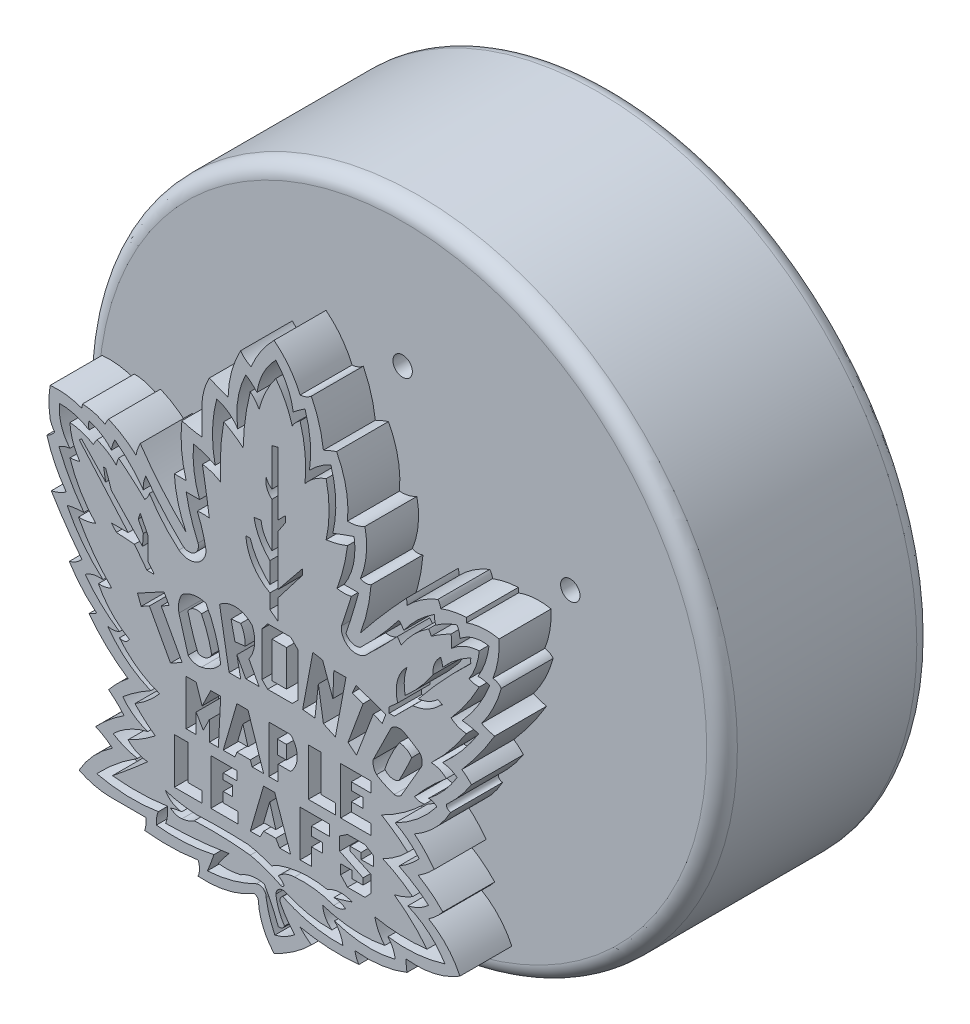
from build123d import *

# Parameters (mm, degrees)
BOSS_EXTRUDE1_DEPTH   = 6.35
SKETCH1_W             = 2.852961581
SKETCH1_H             = 7.051158855
BOSS_EXTRUDE1_2_DEPTH = 6.35
BOSS_EXTRUDE1_3_DEPTH = 6.35
BOSS_EXTRUDE1_4_DEPTH = 6.35
SKETCH1_W_2           = 1.81036161
SKETCH1_H_2           = 2.664627355
BOSS_EXTRUDE1_5_DEPTH = 6.35
BOSS_EXTRUDE1_6_DEPTH = 6.35
BOSS_EXTRUDE1_7_DEPTH = 6.35
BOSS_EXTRUDE1_8_DEPTH = 6.35
BOSS_EXTRUDE1_9_DEPTH = 6.35
BOSS_EXTRUDE2_DEPTH   = 3.81
CUT_EXTRUDE1_START    = -10
CUT_EXTRUDE1_DEPTH    = 10
SKETCH9_R             = 1.5
BOSS_EXTRUDE5_DEPTH   = 5
CHAMFER1_SIZE         = 1
SKETCH12_R            = 62.5
BOSS_EXTRUDE6_DEPTH   = 41.1
SKETCH11_R            = 1.9
CUT_EXTRUDE2_DEPTH    = 5.5
FILLET2_R             = 3


with BuildPart() as part:
    # Sketch1 → Boss-Extrude1 (new body)
    with BuildSketch(Plane.XY):
        with BuildLine():
            ThreePointArc((31.777083768, 91.475184901), (30.744210781, 88.89988469), (30.316738198, 86.158303947))
            Line((30.316738198, 86.158303947), (30.316738198, 80.754563966))
            ThreePointArc((30.316738198, 80.754563966), (28.345069349, 81.064464421), (26.412628573, 81.563652754))
            ThreePointArc((26.412628573, 81.563652754), (26.348154815, 76.652719627), (27.25245451, 71.825332849))
            Line((27.25245451, 71.825332849), (24.936749604, 71.825332849))
            ThreePointArc((24.936749604, 71.825332849), (25.647284418, 67.323512214), (27.25245451, 63.057990238))
            ThreePointArc((27.25245451, 63.057990238), (22.479922445, 68.111002302), (18.264218143, 73.637106759))
            ThreePointArc((18.264218143, 73.637106759), (17.76020467, 72.465316229), (17.45011664, 71.227993296))
            ThreePointArc((17.45011664, 71.227993296), (14.912216224, 73.17683173), (12.08049428, 74.666885619))
            ThreePointArc((12.08049428, 74.666885619), (11.691771045, 74.07096208), (11.395414865, 73.424120807))
            ThreePointArc((11.395414865, 73.424120807), (9.253729625, 74.332671204), (6.951430727, 74.666885619))
            Line((6.951430727, 74.666885619), (6.853416744, 73.88650447))
            ThreePointArc((6.853416744, 73.88650447), (3.789621218, 74.636057042), (0.635620318, 74.666885619))
            ThreePointArc((0.635620318, 74.666885619), (0.405361766, 71.823121051), (0.635620318, 68.979356482))
            ThreePointArc((0.635620318, 68.979356482), (0.997161872, 68.049584838), (1.525854669, 67.20361112))
            ThreePointArc((1.525854669, 67.20361112), (0.856510928, 66.457132048), (0, 65.935940069))
            ThreePointArc((0, 65.935940069), (1.557833724, 61.888236941), (3.789621218, 58.169383474))
            ThreePointArc((3.789621218, 58.169383474), (2.383203992, 57.40068712), (0.856510928, 56.912720124))
            ThreePointArc((0.856510928, 56.912720124), (3.719387044, 52.510300161), (6.853416744, 48.296605936))
            ThreePointArc((6.853416744, 48.296605936), (5.741254393, 47.314530302), (4.381992681, 46.719731811))
            ThreePointArc((4.381992681, 46.719731811), (6.797525946, 43.435491273), (9.746370245, 40.620290716))
            ThreePointArc((9.746370245, 40.620290716), (9.010843754, 40.175899839), (8.237840516, 39.800468801))
            ThreePointArc((8.237840516, 39.800468801), (11.762027213, 35.876941276), (15.895098902, 32.601017205))
            ThreePointArc((15.895098902, 32.601017205), (13.875802672, 30.820319204), (12.08049428, 28.814001578))
            ThreePointArc((12.08049428, 28.814001578), (13.671094075, 27.457229413), (15.098172158, 25.929392195))
            ThreePointArc((15.098172158, 25.929392195), (12.175432065, 23.785122737), (9.539000492, 21.297246189))
            ThreePointArc((9.539000492, 21.297246189), (11.259743903, 20.416002599), (12.825914405, 19.282575004))
            ThreePointArc((12.825914405, 19.282575004), (9.15792439, 16.177442723), (6.305736451, 12.309494792))
            ThreePointArc((6.305736451, 12.309494792), (9.157792295, 11.23378736), (12.175432065, 10.803416318))
            Line((12.175432065, 10.803416318), (19.356830818, 10.803416318))
            ThreePointArc((19.356830818, 10.803416318), (19.388493987, 9.63402411), (19.116284832, 8.496314627))
            ThreePointArc((19.116284832, 8.496314627), (24.356632116, 8.24049503), (29.582258883, 8.709012061))
            ThreePointArc((29.582258883, 8.709012061), (29.860728819, 7.340107774), (29.582258883, 5.971203487))
            ThreePointArc((29.582258883, 5.971203487), (35.246065945, 6.379941426), (40.515481627, 8.496314627))
            ThreePointArc((40.515481627, 8.496314627), (41.115419702, 8.264839925), (41.375962652, 7.676942312))
            ThreePointArc((41.375962652, 7.676942312), (42.295728299, 3.736881996), (44.45, 0.312096226))
            ThreePointArc((44.45, 0.312096226), (48.323342295, 2.54116231), (51.75441677, 5.404594532))
            ThreePointArc((51.75441677, 5.404594532), (50.591344296, 6.304180817), (49.547865306, 7.340107774))
            ThreePointArc((49.547865306, 7.340107774), (55.281147267, 6.583937969), (61.061859969, 6.74417367))
            ThreePointArc((61.061859969, 6.74417367), (60.544560762, 7.676942312), (60.2753251, 8.709012061))
            ThreePointArc((60.2753251, 8.709012061), (65.457969976, 8.766702436), (70.466901417, 10.098521458))
            ThreePointArc((70.466901417, 10.098521458), (70.311165314, 11.198523464), (70.312091935, 12.309494792))
            ThreePointArc((70.312091935, 12.309494792), (75.763308913, 12.568820528), (80.812265027, 14.64030756))
            ThreePointArc((80.812265027, 14.64030756), (78.269159294, 18.4452763), (74.68985187, 21.297246189))
            ThreePointArc((74.68985187, 21.297246189), (76.180703537, 22.461156082), (77.467886181, 23.846972004))
            ThreePointArc((77.467886181, 23.846972004), (75.199859576, 25.927012321), (72.655612453, 27.65828901))
            ThreePointArc((72.655612453, 27.65828901), (74.298190783, 28.852286513), (75.796740996, 30.222702824))
            ThreePointArc((75.796740996, 30.222702824), (73.98998528, 32.384003596), (71.920427295, 34.295159526))
            ThreePointArc((71.920427295, 34.295159526), (75.974421265, 37.390273034), (79.005000936, 41.492733466))
            ThreePointArc((79.005000936, 41.492733466), (78.390017342, 41.785036356), (78.161847628, 42.426584781))
            ThreePointArc((78.161847628, 42.426584781), (80.812265027, 45.159655204), (83.077781427, 48.21936463))
            ThreePointArc((83.077781427, 48.21936463), (82.190019902, 49.094439899), (81.197957462, 49.849217593))
            ThreePointArc((81.197957462, 49.849217593), (84.606394426, 54.148273443), (87.624374121, 58.729880398))
            ThreePointArc((87.624374121, 58.729880398), (86.309162786, 59.063489717), (85.0576452, 59.587684114))
            ThreePointArc((85.0576452, 59.587684114), (87.350123347, 63.339862188), (88.9, 67.454735054))
            ThreePointArc((88.9, 67.454735054), (88.178175039, 68.068703036), (87.268327341, 68.333590042))
            ThreePointArc((87.268327341, 68.333590042), (88.268989094, 71.913500315), (88.49003986, 75.624055268))
            ThreePointArc((88.49003986, 75.624055268), (85.275173274, 75.839753132), (82.123671454, 75.168985649))
            ThreePointArc((82.123671454, 75.168985649), (82.116636427, 75.624055268), (82.082889877, 76.077926419))
            ThreePointArc((82.082889877, 76.077926419), (79.51566493, 75.755228961), (77.032942047, 75.026624365))
            ThreePointArc((77.032942047, 75.026624365), (76.870674948, 75.724622708), (76.505572733, 76.341252801))
            ThreePointArc((76.505572733, 76.341252801), (73.269076335, 74.624721837), (70.466901417, 72.264805903))
            ThreePointArc((70.466901417, 72.264805903), (70.468110403, 72.854961064), (70.312091935, 73.424120807))
            ThreePointArc((70.312091935, 73.424120807), (65.720673124, 68.333590042), (61.343153636, 63.057990238))
            ThreePointArc((61.343153636, 63.057990238), (62.718125694, 67.58652046), (63.433513317, 72.264805903))
            ThreePointArc((63.433513317, 72.264805903), (62.388333476, 72.033004414), (61.343153636, 72.264805903))
            ThreePointArc((61.343153636, 72.264805903), (62.492287232, 76.846687145), (62.238556677, 81.563652754))
            ThreePointArc((62.238556677, 81.563652754), (60.589371137, 80.90920985), (58.821832422, 80.754563966))
            ThreePointArc((58.821832422, 80.754563966), (58.533532573, 86.271364257), (56.679225979, 91.475184901))
            ThreePointArc((56.679225979, 91.475184901), (55.375390851, 90.981091011), (54.102591178, 90.411796879))
            ThreePointArc((54.102591178, 90.411796879), (53.27213802, 94.508116433), (51.75441677, 98.402472419))
            ThreePointArc((51.75441677, 98.402472419), (50.725493325, 97.764575759), (49.547865306, 97.483884014))
            ThreePointArc((49.547865306, 97.483884014), (47.428633418, 101.171403278), (44.45, 104.207302665))
            ThreePointArc((44.45, 104.207302665), (41.881363413, 101.059732663), (39.953048793, 97.483884014))
            ThreePointArc((39.953048793, 97.483884014), (38.809600501, 98.182219065), (37.896894087, 99.163092575))
            ThreePointArc((37.896894087, 99.163092575), (36.133862815, 94.749765226), (35.455283526, 90.04601484))
            ThreePointArc((35.455283526, 90.04601484), (33.607742644, 90.738875589), (31.777083768, 91.475184901))
        make_face()
        with BuildLine():
            Line((27.25245451, 69.920560807), (29.87397881, 69.920560807))
            ThreePointArc((29.87397881, 69.920560807), (28.786511269, 74.286123172), (28.693678502, 78.78413412))
            ThreePointArc((28.693678502, 78.78413412), (30.866119885, 78.173926027), (32.928440755, 77.258126866))
            ThreePointArc((32.928440755, 77.258126866), (32.410998692, 82.985710643), (33.242579649, 88.676179457))
            ThreePointArc((33.242579649, 88.676179457), (35.561965249, 87.526461334), (37.347376196, 85.651972316))
            ThreePointArc((37.347376196, 85.651972316), (37.371439791, 90.750008338), (38.924523106, 95.605776305))
            ThreePointArc((38.924523106, 95.605776305), (40.082873539, 94.72702616), (41.107142659, 93.695110316))
            ThreePointArc((41.107142659, 93.695110316), (42.363597506, 97.652518455), (44.795227957, 101.018069126))
            ThreePointArc((44.795227957, 101.018069126), (47.036281107, 97.739744324), (48.211454198, 93.946500206))
            ThreePointArc((48.211454198, 93.946500206), (49.333622038, 94.81153921), (50.506967928, 95.605776305))
            ThreePointArc((50.506967928, 95.605776305), (51.526793379, 90.680138308), (51.387149579, 85.651972316))
            ThreePointArc((51.387149579, 85.651972316), (53.335625187, 87.35956517), (55.566982928, 88.676179457))
            ThreePointArc((55.566982928, 88.676179457), (56.517095065, 82.992766597), (55.953355802, 77.258126866))
            ThreePointArc((55.953355802, 77.258126866), (58.023214587, 78.047643894), (60.11252899, 78.78413412))
            ThreePointArc((60.11252899, 78.78413412), (59.978759037, 74.040947677), (58.147305603, 69.663563714))
            ThreePointArc((58.147305603, 69.663563714), (59.564919434, 69.692930094), (60.982533265, 69.663563714))
            ThreePointArc((60.982533265, 69.663563714), (59.820690418, 65.612551804), (58.525058709, 61.60232553))
            ThreePointArc((58.525058709, 61.60232553), (59.732458693, 60.53185888), (61.343153636, 60.62868537))
            ThreePointArc((61.343153636, 60.62868537), (65.27530242, 64.668284879), (68.884078898, 68.999207481))
            ThreePointArc((68.884078898, 68.999207481), (69.406293424, 68.410043237), (69.84012892, 67.753073467))
            ThreePointArc((69.84012892, 67.753073467), (72.550858102, 70.869647784), (75.796740996, 73.424120807))
            ThreePointArc((75.796740996, 73.424120807), (75.872912078, 72.581384227), (76.072554614, 71.759100922))
            ThreePointArc((76.072554614, 71.759100922), (78.087535737, 72.979145683), (80.261324636, 73.88650447))
            ThreePointArc((80.261324636, 73.88650447), (80.664233792, 72.889982427), (80.812265027, 71.825332849))
            ThreePointArc((80.812265027, 71.825332849), (83.465814858, 73.295976483), (86.496936505, 73.424120807))
            ThreePointArc((86.496936505, 73.424120807), (85.754441633, 70.196946872), (84.338146708, 67.20361112))
            ThreePointArc((84.338146708, 67.20361112), (85.50971724, 67.130564883), (86.634744357, 66.795561526))
            ThreePointArc((86.634744357, 66.795561526), (84.338146708, 62.23389487), (81.245751106, 58.169383474))
            ThreePointArc((81.245751106, 58.169383474), (82.886523529, 57.946485498), (84.493086221, 57.545519204))
            ThreePointArc((84.493086221, 57.545519204), (81.245751106, 53.097931444), (77.416545938, 49.140228827))
            ThreePointArc((77.416545938, 49.140228827), (78.928455633, 48.798893974), (80.261324636, 48.007793079))
            ThreePointArc((80.261324636, 48.007793079), (77.757867097, 44.614061841), (74.68985187, 41.720622031))
            ThreePointArc((74.68985187, 41.720622031), (75.561528071, 41.562253055), (76.294733966, 41.064951088))
            ThreePointArc((76.294733966, 41.064951088), (72.612087444, 37.21105278), (68.149802816, 34.295159526))
            ThreePointArc((68.149802816, 34.295159526), (70.691496936, 32.648697482), (72.867030847, 30.542017994))
            ThreePointArc((72.867030847, 30.542017994), (70.985896503, 28.803377635), (68.884078898, 27.339171546))
            ThreePointArc((68.884078898, 27.339171546), (71.906030335, 25.650478583), (74.68985187, 23.592758467))
            ThreePointArc((74.68985187, 23.592758467), (72.788830805, 22.259889796), (70.611821657, 21.453012385))
            ThreePointArc((70.611821657, 21.453012385), (74.742371029, 18.939550229), (77.886282449, 15.266029969))
            ThreePointArc((77.886282449, 15.266029969), (72.365168318, 14.146964593), (66.733717693, 14.294519386))
            ThreePointArc((66.733717693, 14.294519386), (67.688056379, 12.842419569), (68.149802816, 11.167263924))
            ThreePointArc((68.149802816, 11.167263924), (62.170495945, 10.584806095), (56.276466815, 11.747470444))
            ThreePointArc((56.276466815, 11.747470444), (57.366655874, 10.189975282), (57.928856555, 8.373871276))
            ThreePointArc((57.928856555, 8.373871276), (51.890176034, 8.86294736), (46.150887046, 10.803416318))
            ThreePointArc((46.150887046, 10.803416318), (45.663098048, 10.216731648), (45.733027849, 9.456964031))
            ThreePointArc((45.733027849, 9.456964031), (46.962136073, 7.376364323), (48.482568917, 5.498097531))
            ThreePointArc((48.482568917, 5.498097531), (46.653381106, 4.277719416), (44.600547389, 3.489604882))
            ThreePointArc((44.600547389, 3.489604882), (43.550773648, 6.177603373), (42.897085139, 8.98830651))
            ThreePointArc((42.897085139, 8.98830651), (42.341939364, 10.224213079), (40.997410276, 10.391226279))
            ThreePointArc((40.997410276, 10.391226279), (36.331021045, 8.592733661), (31.396999358, 7.777139304))
            ThreePointArc((31.396999358, 7.777139304), (32.075182216, 9.456964031), (32.672356714, 11.167263924))
            ThreePointArc((32.672356714, 11.167263924), (27.071811653, 10.391226279), (21.419686909, 10.538960105))
            ThreePointArc((21.419686909, 10.538960105), (21.458906541, 11.799474198), (21.803491885, 13.012608527))
            ThreePointArc((21.803491885, 13.012608527), (15.755159936, 12.633518939), (9.746370245, 13.421221112))
            ThreePointArc((9.746370245, 13.421221112), (13.533102263, 16.959117935), (17.732536424, 19.995695948))
            ThreePointArc((17.732536424, 19.995695948), (15.252512763, 20.663887634), (12.962879073, 21.827749765))
            ThreePointArc((12.962879073, 21.827749765), (16.103947762, 24.142980927), (19.740670892, 25.557495937))
            ThreePointArc((19.740670892, 25.557495937), (17.020434056, 26.91331232), (14.846537692, 29.037483006))
            ThreePointArc((14.846537692, 29.037483006), (17.496621318, 31.026792803), (20.313794155, 32.77145148))
            ThreePointArc((20.313794155, 32.77145148), (15.639572522, 35.521040681), (11.918996308, 39.466405212))
            ThreePointArc((11.918996308, 39.466405212), (13.081158918, 39.403340614), (14.201467228, 39.71879008))
            ThreePointArc((14.201467228, 39.71879008), (10.567488173, 42.602573653), (7.469913709, 46.056128909))
            ThreePointArc((7.469913709, 46.056128909), (9.147958403, 46.815790866), (10.987137436, 46.917480428))
            ThreePointArc((10.987137436, 46.917480428), (7.026152901, 51.110215493), (3.957088187, 55.993786685))
            ThreePointArc((3.957088187, 55.993786685), (5.590938716, 56.305851724), (7.249882166, 56.427337404))
            ThreePointArc((7.249882166, 56.427337404), (4.522091688, 60.6199989), (2.363727831, 65.132283994))
            ThreePointArc((2.363727831, 65.132283994), (3.38680602, 65.678983475), (4.517974712, 65.935940069))
            ThreePointArc((4.517974712, 65.935940069), (2.80689901, 69.014883715), (2.511825369, 72.524955733))
            ThreePointArc((2.511825369, 72.524955733), (5.491693167, 72.12228989), (8.237840516, 70.897370866))
            ThreePointArc((8.237840516, 70.897370866), (8.163043763, 71.665812281), (8.237840516, 72.434253695))
            ThreePointArc((8.237840516, 72.434253695), (10.651262549, 71.397833467), (12.623844922, 69.663563714))
            ThreePointArc((12.623844922, 69.663563714), (12.867505018, 70.741977441), (13.312972015, 71.753859631))
            ThreePointArc((13.312972015, 71.753859631), (16.314422256, 69.1345317), (18.8653592, 66.074743625))
            ThreePointArc((18.8653592, 66.074743625), (18.938556908, 67.396779452), (19.356830818, 68.653037216))
            ThreePointArc((19.356830818, 68.653037216), (22.716902357, 64.493291025), (26.412628573, 60.62868537))
            ThreePointArc((26.412628573, 60.62868537), (28.693680142, 60.280668579), (29.582258883, 62.410161421))
            ThreePointArc((29.582258883, 62.410161421), (28.184075778, 66.092994935), (27.25245451, 69.920560807))
        make_face(mode=Mode.SUBTRACT)
    extrude(amount=BOSS_EXTRUDE1_DEPTH)



with BuildPart() as body_2:
    # Sketch1 → Boss-Extrude1 2 (new body)
    with BuildSketch(Plane.XY):
        with Locations((45.460334002, 49.839451178)):
            Rectangle(SKETCH1_W, SKETCH1_H)
    extrude(amount=BOSS_EXTRUDE1_2_DEPTH)


with BuildPart() as body_3:
    # Sketch1 → Boss-Extrude1 3 (new body)
    with BuildSketch(Plane.XY):
        with BuildLine():
            Line((37.933043602, 52.983684412), (36.039237297, 52.785863851))
            Line((36.039237297, 52.785863851), (36.794544079, 49.315645414))
            Line((36.794544079, 49.315645414), (38.791618635, 49.531062254))
            ThreePointArc((38.791618635, 49.531062254), (38.623744009, 51.322379746), (37.933043602, 52.983684412))
        make_face()
    extrude(amount=BOSS_EXTRUDE1_3_DEPTH)


with BuildPart() as body_4:
    # Sketch1 → Boss-Extrude1 4 (new body)
    with BuildSketch(Plane.XY):
        Polygon((38.347357454, 36.137411256), (37.347376196, 32.77145148), (39.347338713, 32.77145148), align=None)
    extrude(amount=BOSS_EXTRUDE1_4_DEPTH)


with BuildPart() as body_5:
    # Sketch1 → Boss-Extrude1 5 (new body)
    with BuildSketch(Plane.XY):
        with Locations((45.981633987, 35.627473204)):
            Rectangle(SKETCH1_W_2, SKETCH1_H_2)
    extrude(amount=BOSS_EXTRUDE1_5_DEPTH)


with BuildPart() as body_6:
    # Sketch1 → Boss-Extrude1 6 (new body)
    with BuildSketch(Plane.XY):
        Polygon((43.597146553, 25.557495937), (42.39906515, 21.453012385), (44.795227957, 21.453012385), align=None)
    extrude(amount=BOSS_EXTRUDE1_6_DEPTH)


with BuildPart() as body_7:
    # Sketch1 → Boss-Extrude1 7 (new body)
    with BuildSketch(Plane.XY):
        with BuildLine():
            ThreePointArc((31.14651327, 61.913821692), (29.26714633, 59.02657084), (25.838336976, 59.360492968))
            ThreePointArc((25.838336976, 59.360492968), (22.69047481, 62.488230838), (20.054684568, 66.058159436))
            ThreePointArc((20.054684568, 66.058159436), (19.708603815, 65.253398704), (19.131958188, 64.593935631))
            ThreePointArc((19.131958188, 64.593935631), (16.639829558, 66.889241812), (14.014455543, 69.030864295))
            ThreePointArc((14.014455543, 69.030864295), (13.771203811, 68.324887691), (13.59940723, 67.598210112))
            ThreePointArc((13.59940723, 67.598210112), (11.839177317, 69.030864295), (9.803206855, 70.033726015))
            ThreePointArc((9.803206855, 70.033726015), (9.422913733, 69.463121013), (9.104148263, 68.855995407))
            ThreePointArc((9.104148263, 68.855995407), (6.894349709, 69.849550882), (4.517974712, 70.321995594))
            ThreePointArc((4.517974712, 70.321995594), (5.076714405, 67.361731871), (6.43308368, 64.671822255))
            ThreePointArc((6.43308368, 64.671822255), (5.485753907, 64.444232364), (4.517974712, 64.331830017))
            ThreePointArc((4.517974712, 64.331830017), (6.548958279, 59.749762522), (9.539000492, 55.727339826))
            ThreePointArc((9.539000492, 55.727339826), (7.894487306, 55.252958802), (6.187586008, 55.126669718))
            ThreePointArc((6.187586008, 55.126669718), (9.104148263, 50.473267744), (12.69021997, 46.31387175))
            ThreePointArc((12.69021997, 46.31387175), (11.418460399, 45.885888976), (10.080182076, 45.788150581))
            ThreePointArc((10.080182076, 45.788150581), (12.634995017, 42.149170719), (16.117495494, 39.384856332))
            ThreePointArc((16.117495494, 39.384856332), (15.30802686, 38.629413327), (14.201467228, 38.667615215))
            ThreePointArc((14.201467228, 38.667615215), (17.740930787, 35.328118292), (22.077410593, 33.120181502))
            ThreePointArc((22.077410593, 33.120181502), (19.817119773, 30.879853), (17.222190256, 29.037483006))
            ThreePointArc((17.222190256, 29.037483006), (19.131958188, 27.196212545), (21.218126529, 25.557495937))
            ThreePointArc((21.218126529, 25.557495937), (18.642394757, 23.763086808), (15.895098902, 22.244316328))
            ThreePointArc((15.895098902, 22.244316328), (17.643878779, 20.972984623), (19.740670892, 20.445748248))
            ThreePointArc((19.740670892, 20.445748248), (16.323099277, 17.486901612), (12.825914405, 14.622592425))
            ThreePointArc((12.825914405, 14.622592425), (18.212203588, 14.375283205), (23.584633179, 14.833838885))
            ThreePointArc((23.584633179, 14.833838885), (23.598381938, 13.270379603), (23.244345714, 11.747470444))
            ThreePointArc((23.244345714, 11.747470444), (29.469094963, 12.0428192), (35.649643695, 12.840034007))
            ThreePointArc((35.649643695, 12.840034007), (34.560516364, 11.500619503), (33.553366609, 10.098521458))
            ThreePointArc((33.553366609, 10.098521458), (35.75526525, 10.048519198), (37.933043602, 10.377364601))
            ThreePointArc((37.933043602, 10.377364601), (40.173750011, 11.234196991), (42.569332045, 11.10725737))
            ThreePointArc((42.569332045, 11.10725737), (44.029725615, 8.259391974), (45.267657662, 5.30801756))
            ThreePointArc((45.267657662, 5.30801756), (46.013193559, 5.387691802), (46.48402885, 5.971203487))
            ThreePointArc((46.48402885, 5.971203487), (45.377658216, 8.158312798), (44.795227957, 10.539127389))
            ThreePointArc((44.795227957, 10.539127389), (45.506232563, 11.722803112), (46.886814792, 11.747470444))
            ThreePointArc((46.886814792, 11.747470444), (51.231507453, 10.353008187), (55.777538398, 9.959966272))
            ThreePointArc((55.777538398, 9.959966272), (54.510547779, 11.404575728), (53.953324543, 13.243505844))
            ThreePointArc((53.953324543, 13.243505844), (59.988901453, 12.087874638), (66.120509799, 12.496593619))
            ThreePointArc((66.120509799, 12.496593619), (64.884725824, 14.296311584), (64.175333135, 16.360992868))
            ThreePointArc((64.175333135, 16.360992868), (69.262172787, 15.783458869), (74.377589954, 15.9883744))
            ThreePointArc((74.377589954, 15.9883744), (71.398213874, 19.243178115), (67.975487958, 22.028025751))
            ThreePointArc((67.975487958, 22.028025751), (69.830012385, 22.607014421), (71.561892635, 23.487400432))
            ThreePointArc((71.561892635, 23.487400432), (68.76500931, 25.438611957), (65.732207192, 26.998065087))
            ThreePointArc((65.732207192, 26.998065087), (68.317792613, 28.569321786), (70.611821657, 30.542017994))
            ThreePointArc((70.611821657, 30.542017994), (68.130492831, 32.540137897), (65.471663208, 34.295159526))
            ThreePointArc((65.471663208, 34.295159526), (69.94272182, 36.981552342), (73.922124302, 40.35370705))
            ThreePointArc((73.922124302, 40.35370705), (72.896018733, 40.297351135), (71.920427295, 40.620290716))
            ThreePointArc((71.920427295, 40.620290716), (74.903202469, 43.846346111), (78.161847628, 46.793482498))
            ThreePointArc((78.161847628, 46.793482498), (76.799206569, 47.689293315), (75.199886221, 48.007793079))
            ThreePointArc((75.199886221, 48.007793079), (78.902551726, 51.97505501), (82.076230504, 56.37694802))
            ThreePointArc((82.076230504, 56.37694802), (80.484537861, 56.724995189), (79.076929022, 57.545519204))
            ThreePointArc((79.076929022, 57.545519204), (82.076230504, 61.3795315), (84.603731064, 65.539723873))
            ThreePointArc((84.603731064, 65.539723873), (83.570529373, 65.592957648), (82.594464504, 65.935940069))
            ThreePointArc((82.594464504, 65.935940069), (83.946587104, 68.679023777), (84.603731064, 71.665812281))
            ThreePointArc((84.603731064, 71.665812281), (81.686982589, 70.978275154), (79.170855488, 69.350628577))
            ThreePointArc((79.170855488, 69.350628577), (79.202196865, 70.557918501), (79.076929022, 71.759100922))
            ThreePointArc((79.076929022, 71.759100922), (77.104742235, 70.656872806), (75.199886221, 69.441985524))
            ThreePointArc((75.199886221, 69.441985524), (74.977448435, 69.955180024), (74.68985187, 70.434904298))
            ThreePointArc((74.68985187, 70.434904298), (71.741768995, 68.006960779), (69.35800315, 65.023043427))
            ThreePointArc((69.35800315, 65.023043427), (68.949986655, 65.537510051), (68.572450625, 66.074743625))
            ThreePointArc((68.572450625, 66.074743625), (65.732207192, 63.114917662), (62.795527975, 60.250748033))
            ThreePointArc((62.795527975, 60.250748033), (59.392731629, 59.36311734), (57.637045558, 62.410161421))
            ThreePointArc((57.637045558, 62.410161421), (58.637255999, 65.3779406), (59.564919434, 68.369190293))
            ThreePointArc((59.564919434, 68.369190293), (58.168747802, 68.208247926), (56.768931019, 68.333590042))
            ThreePointArc((56.768931019, 68.333590042), (58.039140533, 72.403486951), (58.821832422, 76.594535324))
            ThreePointArc((58.821832422, 76.594535324), (56.768931019, 75.909522515), (54.642883763, 75.505084904))
            ThreePointArc((54.642883763, 75.505084904), (55.222648827, 80.68446019), (54.642883763, 85.863835476))
            ThreePointArc((54.642883763, 85.863835476), (52.368367825, 84.695457327), (50.506967928, 82.942254352))
            ThreePointArc((50.506967928, 82.942254352), (50.522577838, 88.064411303), (49.547865306, 93.092996689))
            ThreePointArc((49.547865306, 93.092996689), (48.679297947, 92.378207177), (48.008563967, 91.475184901))
            ThreePointArc((48.008563967, 91.475184901), (46.709740703, 94.844204666), (44.795227957, 97.905556818))
            ThreePointArc((44.795227957, 97.905556818), (42.81476173, 94.635460776), (41.521263955, 91.037872958))
            ThreePointArc((41.521263955, 91.037872958), (40.755932124, 92.188955447), (39.794135257, 93.181764842))
            ThreePointArc((39.794135257, 93.181764842), (38.814272822, 88.100483934), (38.399286519, 82.942254352))
            ThreePointArc((38.399286519, 82.942254352), (36.577650109, 84.320667239), (34.60879035, 85.479102628))
            ThreePointArc((34.60879035, 85.479102628), (33.99375648, 80.216711466), (34.012747488, 74.918535673))
            ThreePointArc((34.012747488, 74.918535673), (32.294918808, 75.768293132), (30.424873422, 76.187761091))
            ThreePointArc((30.424873422, 76.187761091), (31.147408327, 71.97786068), (31.777083768, 67.753073467))
            ThreePointArc((31.777083768, 67.753073467), (30.598378239, 67.851086343), (29.419672709, 67.753073467))
            ThreePointArc((29.419672709, 67.753073467), (30.456300727, 64.884670263), (31.14651327, 61.913821692))
        make_face()
        Polygon((24.936749604, 18.714071854), (24.936749604, 27.65828901), (27.628264577, 27.65828901), (27.628264577, 20.844414344), (30.367814975, 20.844414344), (30.367814975, 18.714071854), align=None, mode=Mode.SUBTRACT)
        with BuildLine():
            ThreePointArc((26.356859639, 15.266029969), (24.526669093, 15.900672181), (23.191742455, 17.304359839))
            ThreePointArc((23.191742455, 17.304359839), (26.159181042, 16.578150695), (29.195753546, 16.243040376))
            ThreePointArc((29.195753546, 16.243040376), (34.271546129, 16.365721368), (39.347338713, 16.243040376))
            ThreePointArc((39.347338713, 16.243040376), (41.723688761, 15.694757689), (44.015825612, 14.861833857))
            ThreePointArc((44.015825612, 14.861833857), (44.590031456, 15.299932917), (45.239888226, 15.615098457))
            ThreePointArc((45.239888226, 15.615098457), (50.010162965, 16.653448384), (54.883371499, 16.360992868))
            ThreePointArc((54.883371499, 16.360992868), (57.249475406, 17.101827749), (59.690517623, 16.667550292))
            ThreePointArc((59.690517623, 16.667550292), (57.932979324, 16.092988447), (56.144044541, 15.625255049))
            ThreePointArc((56.144044541, 15.625255049), (57.36716897, 15.452118322), (58.452379032, 14.861924444))
            ThreePointArc((58.452379032, 14.861924444), (57.359413384, 14.329239716), (56.144044541, 14.294519386))
            ThreePointArc((56.144044541, 14.294519386), (52.348156452, 15.201809024), (48.445872948, 15.266029969))
            ThreePointArc((48.445872948, 15.266029969), (46.719186965, 14.883358784), (45.267657662, 13.872940848))
            ThreePointArc((45.267657662, 13.872940848), (45.91616037, 13.436392542), (46.421617276, 12.840034007))
            ThreePointArc((46.421617276, 12.840034007), (46.148451396, 12.525702274), (45.733027849, 12.496593619))
            ThreePointArc((45.733027849, 12.496593619), (42.83450764, 13.764942483), (39.794135257, 14.64030756))
            ThreePointArc((39.794135257, 14.64030756), (34.327361138, 15.034344159), (28.846571792, 14.991539259))
            ThreePointArc((28.846571792, 14.991539259), (27.683498826, 14.400661851), (26.412628573, 14.106105177))
            ThreePointArc((26.412628573, 14.106105177), (25.231701968, 14.241544904), (24.201110192, 14.833838885))
            ThreePointArc((24.201110192, 14.833838885), (25.262514818, 15.132086521), (26.356859639, 15.266029969))
        make_face(mode=Mode.SUBTRACT)
        Polygon((32.075851298, 18.714071854), (32.075851298, 27.65828901), (37.183792772, 27.65828901), (37.183792772, 25.929392195), (34.499083172, 25.929392195), (34.499083172, 24.742163089), (36.339156265, 24.742163089), (36.339156265, 22.801069889), (34.499083172, 22.801069889), (34.499083172, 20.844414344), (37.347376196, 20.844414344), (37.347376196, 18.714071854), align=None, mode=Mode.SUBTRACT)
        Polygon((41.727654354, 18.714071854), (39.794135257, 18.714071854), (42.39906515, 27.65828901), (44.570442643, 27.65828901), (47.69128987, 18.714071854), (45.544250293, 18.714071854), (44.795227957, 19.995695948), (42.39906515, 19.995695948), align=None, mode=Mode.SUBTRACT)
        Polygon((18.446145648, 46.121727642), (17.732536424, 48.007793079), (22.922004839, 50.826477967), (23.916482534, 48.995549433), (22.370096439, 48.155622341), (26.462948284, 40.620290716), (24.188395444, 39.384856332), (20.054684568, 46.995413342), align=None, mode=Mode.SUBTRACT)
        Polygon((29.195753546, 29.774311538), (27.25245451, 29.774311538), (27.25245451, 38.667615215), (29.195753546, 38.667615215), (30.367814975, 35.208738892), (32.075851298, 38.667615215), (34.012747488, 38.667615215), (33.553366609, 29.774311538), (31.777083768, 29.774311538), (31.777083768, 33.585958501), (30.607174939, 31.216822732), (29.195753546, 33.585958501), align=None, mode=Mode.SUBTRACT)
        Polygon((36.794544079, 29.774311538), (34.499083172, 29.774311538), (37.183792772, 39.013145935), (39.347338713, 39.013145935), (42.39906515, 29.774311538), (40.167751711, 29.774311538), (39.794135257, 30.787753677), (37.183792772, 30.787753677), align=None, mode=Mode.SUBTRACT)
        with BuildLine():
            Line((27.628264577, 42.426584781), (25.838336976, 48.682665024))
            ThreePointArc((25.838336976, 48.682665024), (25.812560513, 50.445741432), (26.412628573, 52.103758673))
            ThreePointArc((26.412628573, 52.103758673), (28.667944628, 53.144256314), (31.14651327, 52.983684412))
            ThreePointArc((31.14651327, 52.983684412), (32.998787249, 48.663420449), (34.012747488, 44.073487526))
            ThreePointArc((34.012747488, 44.073487526), (32.360320804, 42.53066258), (30.249714951, 41.720622031))
            ThreePointArc((30.249714951, 41.720622031), (28.847164966, 41.732630527), (27.628264577, 42.426584781))
        make_face(mode=Mode.SUBTRACT)
        with BuildLine():
            Line((35.649643695, 43.497966346), (33.791693301, 54.127289845))
            ThreePointArc((33.791693301, 54.127289845), (37.056425922, 55.262636351), (40.167751711, 53.75693299))
            ThreePointArc((40.167751711, 53.75693299), (40.632153693, 50.675243948), (39.530607831, 47.759926939))
            Line((39.530607831, 47.759926939), (41.521263955, 44.073487526))
            Line((41.521263955, 44.073487526), (38.924523106, 44.073487526))
            Line((38.924523106, 44.073487526), (37.183792772, 47.297096483))
            Line((37.183792772, 47.297096483), (37.933043602, 43.497966346))
            Line((37.933043602, 43.497966346), (35.649643695, 43.497966346))
        make_face(mode=Mode.SUBTRACT)
        Polygon((51.75441677, 18.714071854), (49.547865306, 18.714071854), (49.547865306, 27.65828901), (55.249258319, 27.65828901), (55.249258319, 25.557495937), (51.75441677, 25.557495937), (51.75441677, 23.846972004), (53.953324543, 23.846972004), (53.953324543, 22.028025751), (51.75441677, 22.028025751), align=None, mode=Mode.SUBTRACT)
        Polygon((57.475457904, 20.163955337), (57.475457904, 22.028025751), (59.690517623, 22.028025751), (59.690517623, 20.593876848), (61.860090938, 20.593876848), (61.860090938, 21.827749765), (57.296858584, 24.067028347), (57.296858584, 26.652843809), (58.821832422, 27.65828901), (62.238556677, 27.65828901), (63.859068109, 26.652843809), (63.859068109, 24.742163089), (61.489066205, 24.742163089), (61.465240683, 25.929392195), (59.309743118, 25.929392195), (59.309743118, 25.111487577), (63.433513317, 23.183479657), (63.433513317, 19.995695948), (62.238556677, 18.714071854), (58.821832422, 18.714071854), align=None, mode=Mode.SUBTRACT)
        with BuildLine():
            Line((45.239888226, 29.774311538), (43.414878937, 29.774311538))
            Line((43.414878937, 29.774311538), (43.414878937, 39.013145935))
            Line((43.414878937, 39.013145935), (47.69128987, 39.013145935))
            ThreePointArc((47.69128987, 39.013145935), (48.983987118, 35.892298707), (47.69128987, 32.77145148))
            Line((47.69128987, 32.77145148), (45.239888226, 32.77145148))
            Line((45.239888226, 32.77145148), (45.239888226, 29.774311538))
        make_face(mode=Mode.SUBTRACT)
        Polygon((51.155341028, 29.774311538), (51.155341028, 39.013145935), (53.588699063, 39.013145935), (53.588699063, 31.832411699), (56.441748064, 31.832411699), (56.441748064, 29.774311538), align=None, mode=Mode.SUBTRACT)
        Polygon((63.433513317, 29.774311538), (57.475457904, 29.774311538), (57.475457904, 39.013145935), (63.433513317, 39.013145935), (63.433513317, 36.959786881), (59.564919434, 36.959786881), (59.564919434, 35.461755818), (61.860090938, 35.461755818), (61.860090938, 33.585958501), (59.564919434, 33.585958501), (59.564919434, 31.832411699), (63.433513317, 31.832411699), align=None, mode=Mode.SUBTRACT)
        Polygon((42.088061465, 45.553502025), (42.088061465, 54.127289845), (43.191062802, 55.54756528), (47.69128987, 55.54756528), (49.111565305, 54.127289845), (49.111565305, 45.553502025), (48.008563967, 44.450500687), (43.191062802, 44.450500687), align=None, mode=Mode.SUBTRACT)
        Polygon((52.446384635, 44.18813274), (50.041081059, 44.450500687), (52.036230224, 55.126669718), (53.953324543, 54.768405521), (55.953355802, 49.235543437), (56.144044541, 54.127289845), (58.525058709, 54.127289845), (56.441748064, 42.979363178), (54.102591178, 44.073487526), (53.119569647, 50.306930481), align=None, mode=Mode.SUBTRACT)
        Polygon((60.51227392, 53.75693299), (66.328772024, 51.751652526), (65.617632172, 49.89083896), (63.859068109, 50.562902519), (60.567862208, 41.950924759), (58.9206311, 43.323448653), (61.860090938, 51.326843815), (59.744246654, 52.10394393), align=None, mode=Mode.SUBTRACT)
        with BuildLine():
            ThreePointArc((64.492038665, 40.620290716), (63.9223943, 41.678330538), (63.859068109, 42.878302521))
            Line((63.859068109, 42.878302521), (67.31845678, 49.89083896))
            ThreePointArc((67.31845678, 49.89083896), (68.672578753, 50.695475416), (70.199051478, 50.306930481))
            ThreePointArc((70.199051478, 50.306930481), (71.548225555, 49.50733612), (72.867030847, 48.658587372))
            ThreePointArc((72.867030847, 48.658587372), (73.408360671, 47.544047925), (73.260364946, 46.31387175))
            Line((73.260364946, 46.31387175), (69.35800315, 39.577699919))
            ThreePointArc((69.35800315, 39.577699919), (68.738998748, 39.118484776), (67.975487958, 39.013145935))
            ThreePointArc((67.975487958, 39.013145935), (66.174212596, 39.687643522), (64.492038665, 40.620290716))
        make_face(mode=Mode.SUBTRACT)
        Polygon((15.895098902, 57.350596983), (6.305736451, 68.333590042), (6.809570851, 68.653037216), (11.50364743, 63.708108073), (11.100417677, 66.074743625), (11.50364743, 66.074743625), (12.623844922, 62.842093513), (18.713185241, 56.427337404), (18.8653592, 58.673683575), (17.876543352, 60.62868537), (18.264218143, 61.809869897), (19.740670892, 58.890754291), (19.740670892, 54.492207855), (21.025044453, 52.813454427), (19.567566473, 52.813454427), (17.134371342, 55.993786685), (13.59940723, 56.233255334), (12.623844922, 57.350596983), align=None, mode=Mode.SUBTRACT)
        with BuildLine():
            Line((44.033853211, 78.78413412), (44.033853211, 86.158303947))
            Line((44.033853211, 86.158303947), (45.267657662, 86.482806714))
            Line((45.267657662, 86.482806714), (45.267657662, 74.192216218))
            Line((45.267657662, 74.192216218), (46.732282869, 75.656841425))
            Line((46.732282869, 75.656841425), (46.732282869, 74.505233635))
            Line((46.732282869, 74.505233635), (45.267657662, 72.264805903))
            Line((45.267657662, 72.264805903), (45.267657662, 62.410161421))
            Line((45.267657662, 62.410161421), (50.041081059, 68.333590042))
            Line((50.041081059, 68.333590042), (50.041081059, 67.20361112))
            Line((50.041081059, 67.20361112), (45.267657662, 61.008587773))
            Line((45.267657662, 61.008587773), (45.267657662, 56.912720124))
            Line((45.267657662, 56.912720124), (43.636740364, 58.169383474))
            Line((43.636740364, 58.169383474), (43.636740364, 61.008587773))
            ThreePointArc((43.636740364, 61.008587773), (40.348342908, 64.071341994), (38.924523106, 68.333590042))
            Line((38.924523106, 68.333590042), (39.794135257, 68.333590042))
            ThreePointArc((39.794135257, 68.333590042), (41.314225302, 65.111603965), (43.636740364, 62.410161421))
            Line((43.636740364, 62.410161421), (43.636740364, 66.474097569))
            ThreePointArc((43.636740364, 66.474097569), (41.627326905, 69.127551923), (40.515481627, 72.264805903))
            Line((40.515481627, 72.264805903), (41.922367922, 72.434253695))
            Line((41.922367922, 72.434253695), (41.922367922, 72.333180358))
            ThreePointArc((41.922367922, 72.333180358), (42.623879635, 70.146377697), (44.033853211, 68.333590042))
            Line((44.033853211, 68.333590042), (44.033853211, 77.068103885))
            ThreePointArc((44.033853211, 77.068103885), (43.016374875, 78.526908282), (42.897085139, 80.301490596))
            ThreePointArc((42.897085139, 80.301490596), (43.341916181, 79.450249337), (44.033853211, 78.78413412))
        make_face(mode=Mode.SUBTRACT)
        with BuildLine():
            Line((66.978637145, 52.277556991), (66.978637145, 53.365030605))
            Line((66.978637145, 53.365030605), (68.651747845, 54.856083408))
            ThreePointArc((68.651747845, 54.856083408), (68.573822406, 58.590223246), (70.466901417, 61.809869897))
            ThreePointArc((70.466901417, 61.809869897), (69.942389093, 59.360492968), (70.101048657, 56.860615438))
            ThreePointArc((70.101048657, 56.860615438), (73.027114362, 59.769384079), (75.518673121, 63.057990238))
            ThreePointArc((75.518673121, 63.057990238), (75.859426641, 65.095471721), (77.032942047, 66.795561526))
            ThreePointArc((77.032942047, 66.795561526), (77.316614537, 66.057667416), (77.416545938, 65.27346622))
            ThreePointArc((77.416545938, 65.27346622), (79.97535306, 67.725724702), (82.942817554, 69.663563714))
            ThreePointArc((82.942817554, 69.663563714), (82.928368436, 69.158300465), (82.942817554, 68.653037216))
            ThreePointArc((82.942817554, 68.653037216), (77.610842648, 63.273738882), (72.655612453, 57.545519204))
            ThreePointArc((72.655612453, 57.545519204), (74.723499092, 58.149869833), (76.505572733, 59.360492968))
            Line((76.505572733, 59.360492968), (77.416545938, 58.890754291))
            Line((77.416545938, 58.890754291), (77.032942047, 58.685260632))
            ThreePointArc((77.032942047, 58.685260632), (74.551453436, 56.775045213), (71.561892635, 55.842717543))
            Line((71.561892635, 55.842717543), (67.975487958, 52.277556991))
            Line((67.975487958, 52.277556991), (66.978637145, 52.277556991))
        make_face(mode=Mode.SUBTRACT)
    extrude(amount=BOSS_EXTRUDE1_7_DEPTH)


with BuildPart() as body_8:
    # Sketch1 → Boss-Extrude1 8 (new body)
    with BuildSketch(Plane.XY):
        with BuildLine():
            ThreePointArc((30.249714951, 50.754082213), (28.738793172, 50.863459648), (27.59306861, 49.872418138))
            ThreePointArc((27.59306861, 49.872418138), (28.472468503, 46.773640139), (29.571520735, 43.745793801))
            ThreePointArc((29.571520735, 43.745793801), (31.131457651, 43.73226908), (32.244063044, 44.82574763))
            ThreePointArc((32.244063044, 44.82574763), (31.446002993, 47.856898762), (30.249714951, 50.754082213))
        make_face()
    extrude(amount=BOSS_EXTRUDE1_8_DEPTH)


with BuildPart() as body_9:
    # Sketch1 → Boss-Extrude1 9 (new body)
    with BuildSketch(Plane.XY):
        with BuildLine():
            ThreePointArc((71.383323629, 46.954581065), (70.322324898, 47.890763601), (68.96679989, 48.296605936))
            ThreePointArc((68.96679989, 48.296605936), (67.349143266, 45.452267295), (66.120509799, 42.419523477))
            ThreePointArc((66.120509799, 42.419523477), (67.379652665, 41.551086361), (68.884078898, 41.827357047))
            ThreePointArc((68.884078898, 41.827357047), (70.176925051, 44.369899794), (71.383323629, 46.954581065))
        make_face()
    extrude(amount=BOSS_EXTRUDE1_9_DEPTH)


with BuildPart() as part_1:
    add(part.part)

    add(body_2.part)  # Boss-Extrude2 merges body 2

    add(body_3.part)  # Boss-Extrude2 merges body 3

    add(body_4.part)  # Boss-Extrude2 merges body 4

    add(body_5.part)  # Boss-Extrude2 merges body 5

    add(body_6.part)  # Boss-Extrude2 merges body 6

    add(body_7.part)  # Boss-Extrude2 merges body 7

    add(body_8.part)  # Boss-Extrude2 merges body 8

    add(body_9.part)  # Boss-Extrude2 merges body 9
    # Sketch3 → Boss-Extrude2 (add)
    with BuildSketch(Plane(origin=(0, 0, 0), x_dir=(-1, 0, 0), z_dir=(0, 0, -1))):
        with BuildLine():
            Line((5.307296714, 85.933380624), (4.788313025, 18.967709194))
            ThreePointArc((4.788313025, 18.967709194), (-45.556913832, -30.60316825), (-95.127791275, 19.742058607))
            Line((-95.127791275, 19.742058607), (-94.608807587, 86.707730037))
            ThreePointArc((-94.608807587, 86.707730037), (-44.26358073, 136.278607481), (5.307296714, 85.933380624))
        make_face()
    extrude(amount=BOSS_EXTRUDE2_DEPTH)

    # Sketch4 → Cut-Extrude1 (cut)
    with BuildSketch(Plane.XY.offset(CUT_EXTRUDE1_START)):
        with BuildLine():
            Line((-5.307296714, 85.933380624), (-4.788313025, 18.967709194))
            ThreePointArc((-4.788313025, 18.967709194), (45.556913832, -30.60316825), (95.127791275, 19.742058607))
            Line((95.127791275, 19.742058607), (94.608807587, 86.707730037))
            ThreePointArc((94.608807587, 86.707730037), (44.26358073, 136.278607481), (-5.307296714, 85.933380624))
        make_face()
        with BuildLine():
            Line((30.316738198, 86.158303947), (30.316738198, 80.754563966))
            ThreePointArc((30.316738198, 80.754563966), (28.345069349, 81.064464421), (26.412628573, 81.563652754))
            ThreePointArc((26.412628573, 81.563652754), (26.348154815, 76.652719627), (27.25245451, 71.825332849))
            Line((27.25245451, 71.825332849), (24.936749604, 71.825332849))
            ThreePointArc((24.936749604, 71.825332849), (25.647284418, 67.323512214), (27.25245451, 63.057990238))
            ThreePointArc((27.25245451, 63.057990238), (22.479922445, 68.111002302), (18.264218143, 73.637106759))
            ThreePointArc((18.264218143, 73.637106759), (17.76020467, 72.465316229), (17.45011664, 71.227993296))
            ThreePointArc((17.45011664, 71.227993296), (14.912216224, 73.17683173), (12.08049428, 74.666885619))
            ThreePointArc((12.08049428, 74.666885619), (11.691771045, 74.07096208), (11.395414865, 73.424120807))
            ThreePointArc((11.395414865, 73.424120807), (9.253729625, 74.332671204), (6.951430727, 74.666885619))
            Line((6.951430727, 74.666885619), (6.853416744, 73.88650447))
            ThreePointArc((6.853416744, 73.88650447), (3.789621218, 74.636057042), (0.635620318, 74.666885619))
            ThreePointArc((0.635620318, 74.666885619), (0.405361766, 71.823121051), (0.635620318, 68.979356482))
            ThreePointArc((0.635620318, 68.979356482), (0.997161872, 68.049584838), (1.525854669, 67.20361112))
            ThreePointArc((1.525854669, 67.20361112), (0.856510928, 66.457132048), (0, 65.935940069))
            ThreePointArc((0, 65.935940069), (1.557833724, 61.888236941), (3.789621218, 58.169383474))
            ThreePointArc((3.789621218, 58.169383474), (2.383203992, 57.40068712), (0.856510928, 56.912720124))
            ThreePointArc((0.856510928, 56.912720124), (3.719387044, 52.510300161), (6.853416744, 48.296605936))
            ThreePointArc((6.853416744, 48.296605936), (5.741254393, 47.314530302), (4.381992681, 46.719731811))
            ThreePointArc((4.381992681, 46.719731811), (6.797525946, 43.435491273), (9.746370245, 40.620290716))
            ThreePointArc((9.746370245, 40.620290716), (9.010843754, 40.175899839), (8.237840516, 39.800468801))
            ThreePointArc((8.237840516, 39.800468801), (11.762027213, 35.876941276), (15.895098902, 32.601017205))
            ThreePointArc((15.895098902, 32.601017205), (13.875802672, 30.820319204), (12.08049428, 28.814001578))
            ThreePointArc((12.08049428, 28.814001578), (13.671094075, 27.457229413), (15.098172158, 25.929392195))
            ThreePointArc((15.098172158, 25.929392195), (12.175432065, 23.785122737), (9.539000492, 21.297246189))
            ThreePointArc((9.539000492, 21.297246189), (11.259743903, 20.416002599), (12.825914405, 19.282575004))
            ThreePointArc((12.825914405, 19.282575004), (9.15792439, 16.177442723), (6.305736451, 12.309494792))
            ThreePointArc((6.305736451, 12.309494792), (9.157792295, 11.23378736), (12.175432065, 10.803416318))
            Line((12.175432065, 10.803416318), (19.356830818, 10.803416318))
            ThreePointArc((19.356830818, 10.803416318), (19.388493987, 9.63402411), (19.116284832, 8.496314627))
            ThreePointArc((19.116284832, 8.496314627), (24.356632116, 8.24049503), (29.582258883, 8.709012061))
            ThreePointArc((29.582258883, 8.709012061), (29.860728819, 7.340107774), (29.582258883, 5.971203487))
            ThreePointArc((29.582258883, 5.971203487), (35.246065945, 6.379941426), (40.515481627, 8.496314627))
            ThreePointArc((40.515481627, 8.496314627), (41.115419702, 8.264839925), (41.375962652, 7.676942312))
            ThreePointArc((41.375962652, 7.676942312), (42.295728299, 3.736881996), (44.45, 0.312096226))
            ThreePointArc((44.45, 0.312096226), (48.323342295, 2.54116231), (51.75441677, 5.404594532))
            ThreePointArc((51.75441677, 5.404594532), (50.591344296, 6.304180817), (49.547865306, 7.340107774))
            ThreePointArc((49.547865306, 7.340107774), (55.281147267, 6.583937969), (61.061859969, 6.74417367))
            ThreePointArc((61.061859969, 6.74417367), (60.544560762, 7.676942312), (60.2753251, 8.709012061))
            ThreePointArc((60.2753251, 8.709012061), (65.457969976, 8.766702436), (70.466901417, 10.098521458))
            ThreePointArc((70.466901417, 10.098521458), (70.311165314, 11.198523464), (70.312091935, 12.309494792))
            ThreePointArc((70.312091935, 12.309494792), (75.763308913, 12.568820528), (80.812265027, 14.64030756))
            ThreePointArc((80.812265027, 14.64030756), (78.269159294, 18.4452763), (74.68985187, 21.297246189))
            ThreePointArc((74.68985187, 21.297246189), (76.180703537, 22.461156082), (77.467886181, 23.846972004))
            ThreePointArc((77.467886181, 23.846972004), (75.199859576, 25.927012321), (72.655612453, 27.65828901))
            ThreePointArc((72.655612453, 27.65828901), (74.298190783, 28.852286513), (75.796740996, 30.222702824))
            ThreePointArc((75.796740996, 30.222702824), (73.98998528, 32.384003596), (71.920427295, 34.295159526))
            ThreePointArc((71.920427295, 34.295159526), (75.974421265, 37.390273034), (79.005000936, 41.492733466))
            ThreePointArc((79.005000936, 41.492733466), (78.390017342, 41.785036356), (78.161847628, 42.426584781))
            ThreePointArc((78.161847628, 42.426584781), (80.812265027, 45.159655204), (83.077781427, 48.21936463))
            ThreePointArc((83.077781427, 48.21936463), (82.190019902, 49.094439899), (81.197957462, 49.849217593))
            ThreePointArc((81.197957462, 49.849217593), (84.606394426, 54.148273443), (87.624374121, 58.729880398))
            ThreePointArc((87.624374121, 58.729880398), (86.309162786, 59.063489717), (85.0576452, 59.587684114))
            ThreePointArc((85.0576452, 59.587684114), (87.350123347, 63.339862188), (88.9, 67.454735054))
            ThreePointArc((88.9, 67.454735054), (88.178175039, 68.068703036), (87.268327341, 68.333590042))
            ThreePointArc((87.268327341, 68.333590042), (88.268989094, 71.913500315), (88.49003986, 75.624055268))
            ThreePointArc((88.49003986, 75.624055268), (85.275173274, 75.839753132), (82.123671454, 75.168985649))
            ThreePointArc((82.123671454, 75.168985649), (82.116636427, 75.624055268), (82.082889877, 76.077926419))
            ThreePointArc((82.082889877, 76.077926419), (79.51566493, 75.755228961), (77.032942047, 75.026624365))
            ThreePointArc((77.032942047, 75.026624365), (76.870674948, 75.724622708), (76.505572733, 76.341252801))
            ThreePointArc((76.505572733, 76.341252801), (73.269076335, 74.624721837), (70.466901417, 72.264805903))
            ThreePointArc((70.466901417, 72.264805903), (70.468110403, 72.854961064), (70.312091935, 73.424120807))
            ThreePointArc((70.312091935, 73.424120807), (65.720673124, 68.333590042), (61.343153636, 63.057990238))
            ThreePointArc((61.343153636, 63.057990238), (62.718125694, 67.58652046), (63.433513317, 72.264805903))
            ThreePointArc((63.433513317, 72.264805903), (62.388333476, 72.033004414), (61.343153636, 72.264805903))
            ThreePointArc((61.343153636, 72.264805903), (62.492287232, 76.846687145), (62.238556677, 81.563652754))
            ThreePointArc((62.238556677, 81.563652754), (60.589371137, 80.90920985), (58.821832422, 80.754563966))
            ThreePointArc((58.821832422, 80.754563966), (58.533532573, 86.271364257), (56.679225979, 91.475184901))
            ThreePointArc((56.679225979, 91.475184901), (55.375390851, 90.981091011), (54.102591178, 90.411796879))
            ThreePointArc((54.102591178, 90.411796879), (53.27213802, 94.508116433), (51.75441677, 98.402472419))
            ThreePointArc((51.75441677, 98.402472419), (50.725493325, 97.764575759), (49.547865306, 97.483884014))
            ThreePointArc((49.547865306, 97.483884014), (47.428633418, 101.171403278), (44.45, 104.207302665))
            ThreePointArc((44.45, 104.207302665), (41.881363413, 101.059732663), (39.953048793, 97.483884014))
            ThreePointArc((39.953048793, 97.483884014), (38.809600501, 98.182219065), (37.896894087, 99.163092575))
            ThreePointArc((37.896894087, 99.163092575), (36.133862815, 94.749765226), (35.455283526, 90.04601484))
            ThreePointArc((35.455283526, 90.04601484), (33.607742644, 90.738875589), (31.777083768, 91.475184901))
            ThreePointArc((31.777083768, 91.475184901), (30.744210781, 88.89988469), (30.316738198, 86.158303947))
        make_face(mode=Mode.SUBTRACT)
    extrude(amount=CUT_EXTRUDE1_DEPTH, mode=Mode.SUBTRACT)

    # Sketch9 → Boss-Extrude5 (add)
    with BuildSketch(Plane(origin=(0, 0, -3.81), x_dir=(-1, 0, 0), z_dir=(0, 0, -1))):
        with Locations((-44.45, 87.259699446)):
            Circle(SKETCH9_R)
        with Locations((-77.252286342, 65.694728288)):
            Circle(SKETCH9_R)
        with Locations((-10.737216075, 65.694728288)):
            Circle(SKETCH9_R)
        with Locations((-44.45, 17.259699446)):
            Circle(SKETCH9_R)
    extrude(amount=BOSS_EXTRUDE5_DEPTH)

    # Chamfer1
    chamfer1_edges = [part_1.edges().sort_by_distance(p)[0] for p in [
        (78.752286342, 65.694728288, -8.81),
        (45.95, 17.259699446, -8.81),
        (12.237216075, 65.694728288, -8.81),
        (45.95, 87.259699446, -8.81),
    ]]
    chamfer(chamfer1_edges, length=CHAMFER1_SIZE)


with BuildPart() as body_2_2:
    # Sketch12 → Boss-Extrude6 (new body)
    with BuildSketch(Plane(origin=(0, 0, -18.81), x_dir=(-1, 0, 0), z_dir=(0, 0, -1))):
        with Locations((-44.45, 52.259699446)):
            Circle(SKETCH12_R)
    extrude(amount=BOSS_EXTRUDE6_DEPTH)

    # Sketch11 → Cut-Extrude2 (cut)
    with BuildSketch(Plane(origin=(0, 0, -18.81), x_dir=(-1, 0, 0), z_dir=(0, 0, -1))):
        with Locations((-44.45, 87.259699446)):
            Circle(SKETCH11_R)
        with Locations((-77.252286342, 65.694728288)):
            Circle(SKETCH11_R)
        with Locations((-44.45, 17.259699446)):
            Circle(SKETCH11_R)
        with Locations((-10.737216075, 65.694728288)):
            Circle(SKETCH11_R)
    extrude(amount=CUT_EXTRUDE2_DEPTH, mode=Mode.SUBTRACT)

    # Fillet2
    fillet2_edges = [body_2_2.edges().sort_by_distance(p)[0] for p in [
        (106.95, 52.259699446, -18.81),
        (106.95, 52.259699446, -59.91),
    ]]
    fillet(fillet2_edges, radius=FILLET2_R)


solid = Compound([part_1.part, body_2_2.part])
